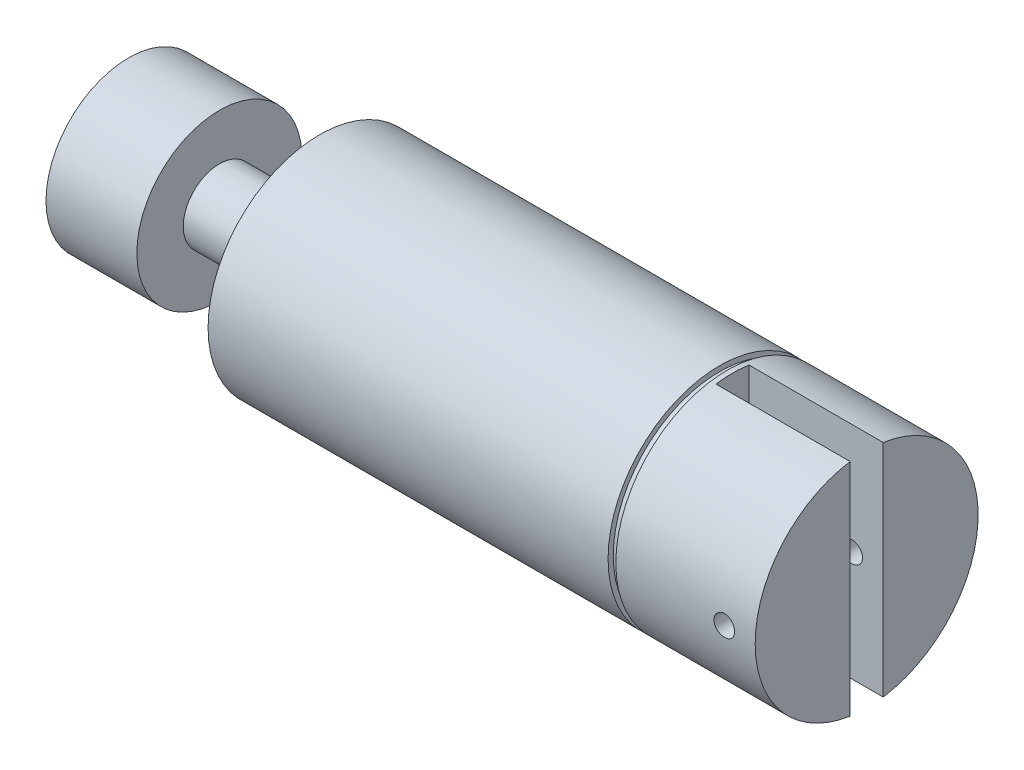
from build123d import *

# Parameters (mm, degrees)
CUT_EXTRUDE1_DEPTH      = 60.252362822
CUT_EXTRUDE1_DEPTH_BACK = 60.252362822
SKETCH2_R               = 1
CUT_EXTRUDE2_DEPTH      = 60.252362859
CUT_EXTRUDE2_DEPTH_BACK = 60.252362859
SKETCH3_W               = 26
SKETCH3_H               = 3.2


with BuildPart() as part:
    # Sketch1 → Revolve1 (revolve)
    with BuildSketch(Plane.XY):
        Polygon((-57.25, 0), (-57.25, 8), (-57.042201581, 8), (-48.45, 8), (-48.45, 5.8595471), (-48.45, 3.504470165), (-38.75, 3.504470165), (-38.75, 10.8), (-33.89, 10.8), (0, 10.8), (0, 10.3), (0.75, 10.3), (0.75, 10.8), (14.25, 10.8), (14.25, 0), align=None)
    revolve(axis=Axis((-38.390119341, 0, 0), (1, 0, 0)))

    # Sketch2 → Cut-Extrude1 (cut, two sides: drawn at the far end of the back side and taken through both)
    with BuildSketch(Plane.XY.offset(-CUT_EXTRUDE1_DEPTH_BACK)):
        with Locations((11.25, 0)):
            Circle(SKETCH2_R)
    extrude(amount=CUT_EXTRUDE1_DEPTH + CUT_EXTRUDE1_DEPTH_BACK, mode=Mode.SUBTRACT)

    # Sketch3 → Cut-Extrude2 (cut, two sides: drawn at the far end of the back side and taken through both)
    with BuildSketch(Plane(origin=(0, 0, 0), x_dir=(1, 0, 0), z_dir=(0, 1, 0)).offset(-CUT_EXTRUDE2_DEPTH_BACK)):
        with Locations((14.25, 0)):
            Rectangle(SKETCH3_W, SKETCH3_H)
    extrude(amount=CUT_EXTRUDE2_DEPTH + CUT_EXTRUDE2_DEPTH_BACK, mode=Mode.SUBTRACT)


solid = part.part
